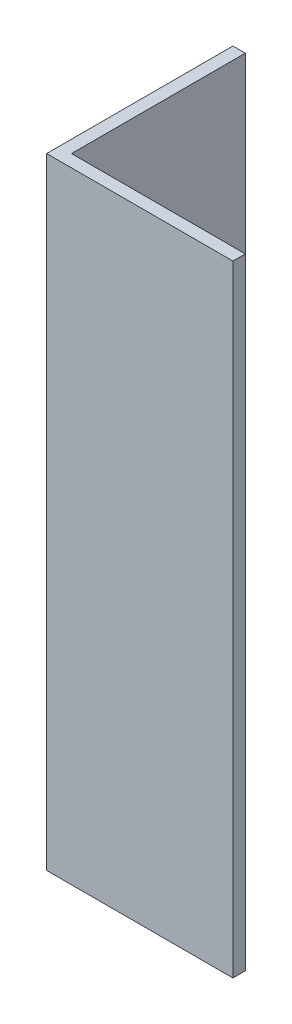
from build123d import *

# Parameters (mm, degrees)
EXTRUDE_1_DEPTH     = 50
SKETCH_2_R          = 2.25
CUT_EXTRUDE_1_DEPTH = 55.046276467


with BuildPart() as part:
    # Эскиз1 → Бобышка-Вытянуть1 (new body)
    with BuildSketch(Plane(origin=(0, 0, 0), x_dir=(1, 0, 0), z_dir=(0, 1, 0))):
        Polygon((0, 0), (0, 15), (1, 15), (1, 1), (15, 1), (15, 0), align=None)
    extrude(amount=EXTRUDE_1_DEPTH)

    # Эскиз2 → Вырез-Вытянуть1 (cut, through all)
    with BuildSketch(Plane(origin=(1, 0, 0), x_dir=(0, 0, -1), z_dir=(1, 0, 0))):
        with Locations((10.5, 9.5)):
            Circle(SKETCH_2_R)
        with Locations((10.5, 160.5)):
            Circle(SKETCH_2_R)
    extrude(amount=-CUT_EXTRUDE_1_DEPTH, mode=Mode.SUBTRACT)


solid = part.part
